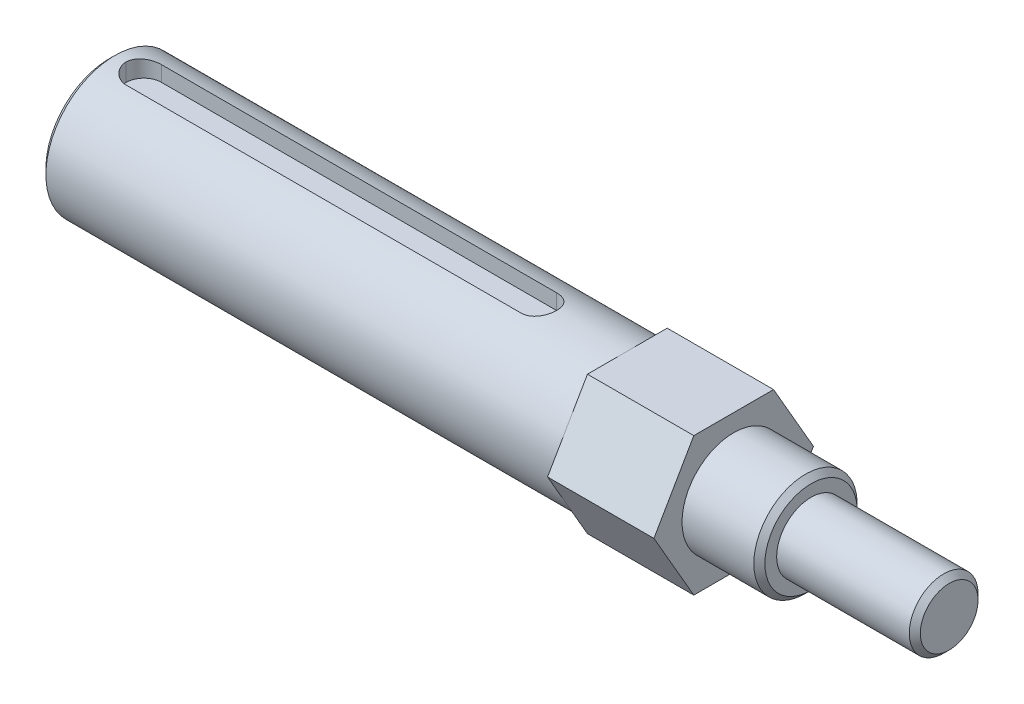
from build123d import *

# Parameters (mm, degrees)
EXTRUDE1_DEPTH = 9.779
EXTRUDE3_START = -41.1226
EXTRUDE3_DEPTH = 39.5732
FILLET1_R      = 1.6256
CHAMFER1_SIZE  = 0.508092456


with BuildPart() as part:
    # Sketch1 → Revolve1 (revolve)
    with BuildSketch(Plane.XY, mode=Mode.PRIVATE) as revolve1_sk:
        Polygon((-60.8076, 2.48793), (-60.8076, 6.3373), (-3.4036, 6.3373), (-3.4036, 4.7498), (3.7084, 4.7498), (3.7084, 3.16215), (16.4084, 3.16215), (16.4084, 0), (-43.43770084, 0), (-44.9326, 2.48793), align=None)
    revolve(revolve1_sk.sketch.rotate(Axis((-77.896651655, 0, 0), (1, 0, 0)), 90), axis=Axis((-77.896651655, 0, 0), (1, 0, 0)))

    # Sketch2 → Extrude1 (add)
    with BuildSketch(Plane(origin=(-3.4036, 0, 0), x_dir=(0, 0, -1), z_dir=(1, 0, 0))):
        Polygon((-7.332348419, 0), (-3.666174209, -6.35), (3.666174209, -6.35), (7.332348419, 0), (3.666174209, 6.35), (-3.666174209, 6.35), align=None)
    extrude(amount=-EXTRUDE1_DEPTH)

    # Sketch4 → Extrude3 (cut)
    with BuildSketch(Plane.ZY.offset(60.8076).offset(EXTRUDE3_START)):
        with BuildLine():
            Line((-1.6256, 6.125258846), (-1.6256, 4.7117))
            Line((-1.6256, 4.7117), (1.6256, 4.7117))
            Line((1.6256, 4.7117), (1.6256, 6.125258846))
            ThreePointArc((1.6256, 6.125258846), (0, 6.3373), (-1.6256, 6.125258846))
        make_face()
    extrude(amount=EXTRUDE3_DEPTH, mode=Mode.SUBTRACT)

    # Fillet1
    fillet1_edges = [part.edges().sort_by_distance(p)[0] for p in [
        (-19.685, 5.418479423, 1.6256),
        (-19.685, 5.418479423, -1.6256),
        (-59.2582, 5.418479423, 1.6256),
        (-59.2582, 5.418479423, -1.6256),
    ]]
    fillet(fillet1_edges, radius=FILLET1_R - 0.0001)  # a hair under: the kernel refuses the full size

    # Chamfer1
    chamfer1_edges = [part.edges().sort_by_distance(p)[0] for p in [
        (-60.8076, 0, -6.3373),
        (3.7084, 0, -4.7498),
        (16.4084, 0, -3.16215),
    ]]
    chamfer(chamfer1_edges, length=CHAMFER1_SIZE)


solid = part.part
